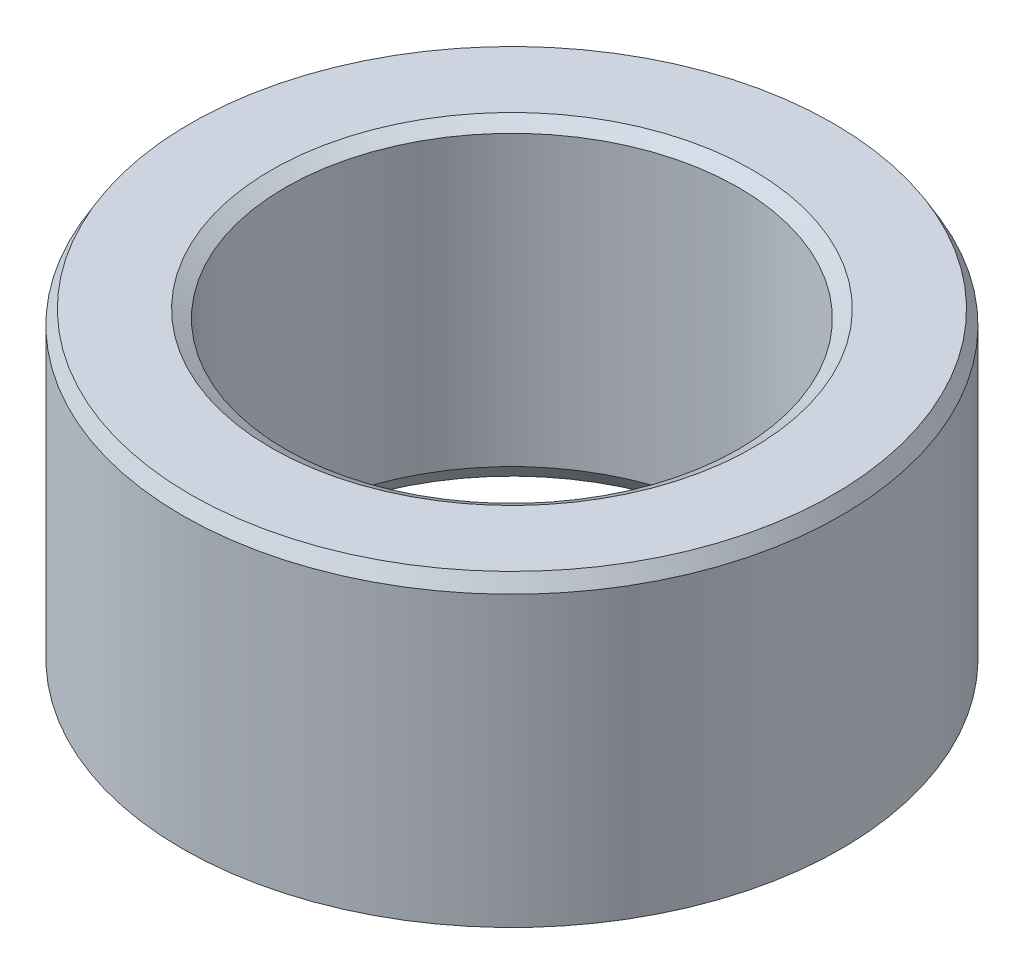
from build123d import *
from OCP.BRepFilletAPI import BRepFilletAPI_MakeChamfer

# Parameters (mm, degrees)
SKETCH1_R           = 35
BOSS_EXTRUDE1_DEPTH = 33.003276941
SKETCH2_R           = 24.068481349
CUT_EXTRUDE1_DEPTH  = 60.491312718
CHAMFER1_SIZE       = 1.491918611
CHAMFER1_SIZE2      = 0.861359612


with BuildPart() as part:
    # Sketch1 → Boss-Extrude1 (new body)
    with BuildSketch(Plane(origin=(0, 0, 0), x_dir=(1, 0, 0), z_dir=(0, 1, 0))):
        Circle(SKETCH1_R)
    extrude(amount=BOSS_EXTRUDE1_DEPTH)

    # Sketch2 → Cut-Extrude1 (cut, through all)
    with BuildSketch(Plane(origin=(0, 0, 0), x_dir=(1, 0, 0), z_dir=(0, 1, 0))):
        Circle(SKETCH2_R)
    extrude(amount=CUT_EXTRUDE1_DEPTH, mode=Mode.SUBTRACT)

    # Chamfer1: one chamfer whose edges measure the first distance from different faces: ONE call of the kernel's chamfer builder (chamfer() names one face for all edges)
    chamfer1_edges_1 = [part.edges().sort_by_distance(p)[0] for p in [
        (-24.068481349, 33.003276941, 0),
    ]]
    chamfer1_side_1 = [part.faces().sort_by_distance(p)[0] for p in [
        (-34.010050506, 33.003276941, 0),
    ]]
    chamfer1_edges_2 = [part.edges().sort_by_distance(p)[0] for p in [
        (-24.068481349, 0, 0),
    ]]
    chamfer1_side_2 = [part.faces().sort_by_distance(p)[0] for p in [
        (-24.068481349, 16.501638471, 0),
    ]]
    chamfer1_edges_3 = [part.edges().sort_by_distance(p)[0] for p in [
        (-35, 0, 0),
    ]]
    chamfer1_side_3 = [part.faces().sort_by_distance(p)[0] for p in [
        (-34.010050506, 0, 0),
    ]]
    chamfer1_edges_4 = [part.edges().sort_by_distance(p)[0] for p in [
        (-35, 33.003276941, 0),
    ]]
    chamfer1_side_4 = [part.faces().sort_by_distance(p)[0] for p in [
        (-35, 16.501638471, 0),
    ]]
    chamfer1 = BRepFilletAPI_MakeChamfer(part.part.solid().wrapped)
    for e in chamfer1_edges_1:
        chamfer1.Add(CHAMFER1_SIZE, CHAMFER1_SIZE2, e.wrapped, chamfer1_side_1[0].wrapped)  # the first distance lies on this face
    for e in chamfer1_edges_2:
        chamfer1.Add(CHAMFER1_SIZE, CHAMFER1_SIZE2, e.wrapped, chamfer1_side_2[0].wrapped)  # the first distance lies on this face
    for e in chamfer1_edges_3:
        chamfer1.Add(CHAMFER1_SIZE, CHAMFER1_SIZE2, e.wrapped, chamfer1_side_3[0].wrapped)  # the first distance lies on this face
    for e in chamfer1_edges_4:
        chamfer1.Add(CHAMFER1_SIZE, CHAMFER1_SIZE2, e.wrapped, chamfer1_side_4[0].wrapped)  # the first distance lies on this face
    add(Compound.cast(chamfer1.Shape()), mode=Mode.REPLACE)


solid = part.part
